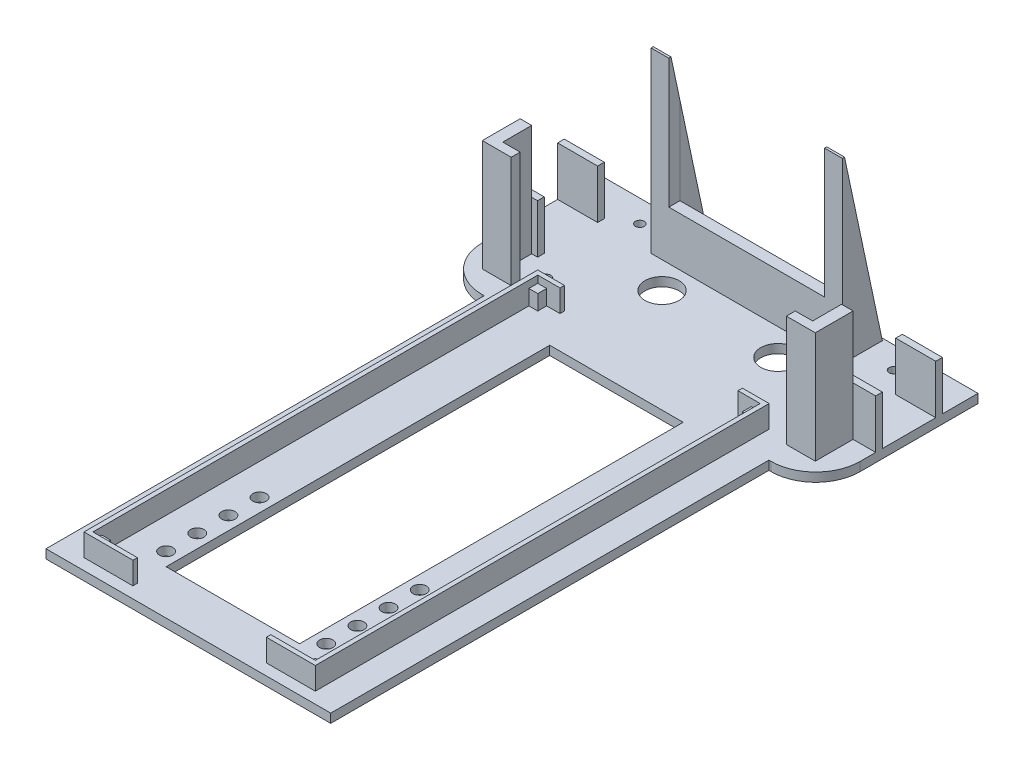
from build123d import *
from OCP.BRepFilletAPI import BRepFilletAPI_MakeChamfer

# Parameters (mm, degrees)
BASE_W               = 85
BASE_H               = 100
BOSS_EXTRUDE2_DEPTH  = 2
SKETCH3_W            = 9
SKETCH3_H            = 1.5
SKETCH3_W_2          = 43
SKETCH3_H_2          = 2.5
BOSS_EXTRUDE4_DEPTH  = 11
SKETCH13_W           = 15
SKETCH13_H           = 61.230763763
SKETCH13_R           = 1
CUT_EXTRUDE2_DEPTH   = 67.537583365
SKETCH14_W           = 2.595547293
SKETCH14_H           = 6.5
SKETCH14_W_2         = 6.5
SKETCH14_H_2         = 2
BOSS_EXTRUDE5_DEPTH  = 25
SKETCH16_W           = 3.995410841
SKETCH16_H           = 2.5
BOSS_EXTRUDE6_DEPTH  = 29
SKETCH18_W           = 4
SKETCH18_H           = 6.5
BOSS_EXTRUDE7_DEPTH  = 40
CHAMFER1_SIZE        = 8.502262467
CHAMFER1_SIZE_2      = 40
SKETCH19_W           = 10.5
SKETCH19_H           = 63.5
CUT_EXTRUDE3_DEPTH   = 77.852130745
BOSS_EXTRUDE8_DEPTH  = 5
FILLET1_R            = 10
SKETCH21_W           = 2
SKETCH21_H           = 2
BOSS_EXTRUDE9_DEPTH  = 3.4
SKETCH22_W           = 64
SKETCH22_H           = 2
BOSS_EXTRUDE10_DEPTH = 35
SKETCH23_R           = 1.5
SKETCH23_W           = 30
SKETCH23_H           = 27.486629776
CUT_EXTRUDE4_DEPTH   = 104.107953137
SKETCH24_W           = 1
SKETCH24_H           = 32.46
SKETCH24_W_2         = 10
SKETCH24_H_2         = 1
BOSS_EXTRUDE11_DEPTH = 5
SKETCH26_W           = 2
SKETCH26_H           = 2
BOSS_EXTRUDE13_DEPTH = 3.4


with BuildPart() as part:
    # base → Boss-Extrude2 (new body)
    with BuildSketch(Plane(origin=(0, 0, 0), x_dir=(1, 0, 0), z_dir=(0, 1, 0))):
        Rectangle(BASE_W, BASE_H)
    extrude(amount=BOSS_EXTRUDE2_DEPTH)

    # Sketch3 → Boss-Extrude4 (add)
    with BuildSketch(Plane(origin=(0, 2, 0), x_dir=(1, 0, 0), z_dir=(0, 1, 0))):
        with Locations((38, 41.25)):
            Rectangle(SKETCH3_W, SKETCH3_H)
        with Locations((38, 27.75)):
            Rectangle(SKETCH3_W, SKETCH3_H)
        with Locations((-38, 41.25)):
            Rectangle(SKETCH3_W, SKETCH3_H)
        with Locations((-38, 27.75)):
            Rectangle(SKETCH3_W, SKETCH3_H)
        with Locations((0, 41.75)):
            Rectangle(SKETCH3_W_2, SKETCH3_H_2)
    extrude(amount=BOSS_EXTRUDE4_DEPTH)

    # Sketch13 → Cut-Extrude2 (cut, through all)
    with BuildSketch(Plane(origin=(0, 2, 0), x_dir=(1, 0, 0), z_dir=(0, 1, 0))):
        with BuildLine():
            ThreePointArc((-16.872793903, 34.5), (-13.024991104, 30.652197201), (-9.177188305, 34.5))
            Line((-9.177188305, 34.5), (-16.872793903, 34.5))
        make_face()
        with BuildLine():
            Line((-16.872793903, 34.5), (-9.177188305, 34.5))
            ThreePointArc((-9.177188305, 34.5), (-13.024991104, 38.347802799), (-16.872793903, 34.5))
        make_face()
        with BuildLine():
            ThreePointArc((9.177188305, 34.5), (13.024991104, 30.652197201), (16.872793903, 34.5))
            Line((16.872793903, 34.5), (9.177188305, 34.5))
        make_face()
        with BuildLine():
            Line((9.177188305, 34.5), (16.872793903, 34.5))
            ThreePointArc((16.872793903, 34.5), (13.024991104, 38.347802799), (9.177188305, 34.5))
        make_face()
        with Locations((-7.5, -19.384618119)):
            Rectangle(SKETCH13_W, SKETCH13_H)
        with Locations((7.5, -19.384618119)):
            Rectangle(SKETCH13_W, SKETCH13_H)
        with Locations(Location((28.5, 45, 0), (0, 0, 270))):
            Circle(SKETCH13_R)
        with Locations(Location((28.5, 24, 0), (0, 0, 90))):
            Circle(SKETCH13_R)
        with Locations(Location((-28.5, 24, 0), (0, 0, 270))):
            Circle(SKETCH13_R)
        with Locations(Location((-28.5, 45, 0), (0, 0, 90))):
            Circle(SKETCH13_R)
    extrude(amount=-CUT_EXTRUDE2_DEPTH, mode=Mode.SUBTRACT)

    # Sketch14 → Boss-Extrude5 (add)
    with BuildSketch(Plane(origin=(0, 2, 0), x_dir=(1, 0, 0), z_dir=(0, 1, 0))):
        with Locations((-36.123593927, 23.75)):
            Rectangle(SKETCH14_W, SKETCH14_H)
        with Locations((-34.171367573, 19.5)):
            Rectangle(SKETCH14_W_2, SKETCH14_H_2)
        with Locations((36.123593927, 23.75)):
            Rectangle(SKETCH14_W, SKETCH14_H)
        Polygon((37.421367573, 20.5), (34.82582028, 20.5), (30.921367573, 20.5), (30.921367573, 18.5), (37.421367573, 18.5), align=None)
    extrude(amount=BOSS_EXTRUDE5_DEPTH)

    # Sketch16 → Boss-Extrude6 (add)
    with BuildSketch(Plane(origin=(0, 13, 0), x_dir=(1, 0, 0), z_dir=(0, 1, 0))):
        with Locations((-19.50229458, 41.75)):
            Rectangle(SKETCH16_W, SKETCH16_H)
        with Locations((19.50229458, 41.75)):
            Rectangle(SKETCH16_W, SKETCH16_H)
    extrude(amount=BOSS_EXTRUDE6_DEPTH)

    # Sketch18 → Boss-Extrude7 (add)
    with BuildSketch(Plane(origin=(0, 2, 0), x_dir=(1, 0, 0), z_dir=(0, 1, 0))):
        with Locations((-19.5, 46.25)):
            Rectangle(SKETCH18_W, SKETCH18_H)
        with Locations((19.5, 46.25)):
            Rectangle(SKETCH18_W, SKETCH18_H)
    extrude(amount=BOSS_EXTRUDE7_DEPTH)

    # Chamfer1
    chamfer1_edges_1 = [part.edges().sort_by_distance(p)[0] for p in [
        (-19.5, 42, -49.5),
    ]]
    chamfer1_side_1 = [part.faces().sort_by_distance(p)[0] for p in [
        (-19.5, 42, -49.329954751),
    ]]
    chamfer1_edges_2 = [part.edges().sort_by_distance(p)[0] for p in [
        (19.5, 42, -49.5),
    ]]
    chamfer1_side_2 = [part.faces().sort_by_distance(p)[0] for p in [
        (19.5, 42, -49.329954751),
    ]]
    chamfer1 = BRepFilletAPI_MakeChamfer(part.part.solid().wrapped)
    for e in chamfer1_edges_1:
        chamfer1.Add(CHAMFER1_SIZE - 0.0001, CHAMFER1_SIZE_2 - 0.0001, e.wrapped, chamfer1_side_1[0].wrapped)
    for e in chamfer1_edges_2:
        chamfer1.Add(CHAMFER1_SIZE - 0.0001, CHAMFER1_SIZE_2 - 0.0001, e.wrapped, chamfer1_side_2[0].wrapped)
    add(Compound.cast(chamfer1.Shape()), mode=Mode.REPLACE)  # a hair under: the kernel refuses the full size

    # Sketch19 → Cut-Extrude3 (cut, through all)
    with BuildSketch(Plane(origin=(0, 2, 0), x_dir=(1, 0, 0), z_dir=(0, 1, 0))):
        with Locations((-37.25, -18.25)):
            Rectangle(SKETCH19_W, SKETCH19_H)
        with Locations((37.25, -18.25)):
            Rectangle(SKETCH19_W, SKETCH19_H)
    extrude(amount=-CUT_EXTRUDE3_DEPTH, mode=Mode.SUBTRACT)

    # Sketch20 → Boss-Extrude8 (add)
    with BuildSketch(Plane(origin=(0, 2, 0), x_dir=(1, 0, 0), z_dir=(0, 1, 0))):
        Polygon((-26, -50), (-25, -50), (-25, 18.538863673), (-20, 18.538863673), (-20, 19.538863673), (-26, 19.538863673), align=None)
        Polygon((20, 18.538863673), (25, 18.538863673), (25, -50), (26, -50), (26, 19.538863673), (20, 19.538863673), align=None)
    extrude(amount=BOSS_EXTRUDE8_DEPTH)

    # Fillet1
    fillet1_edges = [part.edges().sort_by_distance(p)[0] for p in [
        (-42.5, 1, -13.5),
        (42.5, 1, -13.5),
    ]]
    fillet(fillet1_edges, radius=FILLET1_R)

    # Sketch21 → Boss-Extrude9 (add)
    with BuildSketch(Plane(origin=(0, 2, 0), x_dir=(1, 0, 0), z_dir=(0, 1, 0))):
        with Locations((-24, 17.538863673)):
            Rectangle(SKETCH21_W, SKETCH21_H)
        with Locations((24, 17.538863673)):
            Rectangle(SKETCH21_W, SKETCH21_H)
    extrude(amount=BOSS_EXTRUDE9_DEPTH)

    # Sketch22 → Boss-Extrude10 (add)
    with BuildSketch(Plane.XY.offset(50)):
        with Locations((0, 1)):
            Rectangle(SKETCH22_W, SKETCH22_H)
    extrude(amount=BOSS_EXTRUDE10_DEPTH)

    # Sketch23 → Cut-Extrude4 (cut, through all)
    with BuildSketch(Plane(origin=(0, 2, 0), x_dir=(1, 0, 0), z_dir=(0, 1, 0))):
        with Locations(Location((18, -72, 0), (0, 0, 270))):
            Circle(SKETCH23_R)
        with Locations(Location((18, -65, 0), (0, 0, 270))):
            Circle(SKETCH23_R)
        with Locations(Location((18, -58, 0), (0, 0, 270))):
            Circle(SKETCH23_R)
        with Locations(Location((18, -51, 0), (0, 0, 270))):
            Circle(SKETCH23_R)
        with Locations(Location((-18, -51, 0), (0, 0, 90))):
            Circle(SKETCH23_R)
        with Locations(Location((-18, -58, 0), (0, 0, 90))):
            Circle(SKETCH23_R)
        with Locations(Location((-18, -65, 0), (0, 0, 90))):
            Circle(SKETCH23_R)
        with Locations(Location((-18, -72, 0), (0, 0, 90))):
            Circle(SKETCH23_R)
        with Locations((0, -61.256685112)):
            Rectangle(SKETCH23_W, SKETCH23_H)
    extrude(amount=-CUT_EXTRUDE4_DEPTH, mode=Mode.SUBTRACT)

    # Sketch24 → Boss-Extrude11 (add)
    with BuildSketch(Plane(origin=(0, 2, 0), x_dir=(1, 0, 0), z_dir=(0, 1, 0))):
        with Locations((-25.5, -66.23)):
            Rectangle(SKETCH24_W, SKETCH24_H)
        with Locations((-20, -81.96)):
            Rectangle(SKETCH24_W_2, SKETCH24_H_2)
        with Locations((25.5, -66.23)):
            Rectangle(SKETCH24_W, SKETCH24_H)
        with Locations((20, -81.96)):
            Rectangle(SKETCH24_W_2, SKETCH24_H_2)
    extrude(amount=BOSS_EXTRUDE11_DEPTH)

    # Sketch26 → Boss-Extrude13 (add)
    with BuildSketch(Plane(origin=(0, 2, 0), x_dir=(1, 0, 0), z_dir=(0, 1, 0))):
        with Locations((24, -80.46)):
            Rectangle(SKETCH26_W, SKETCH26_H)
        with Locations((-24, -80.46)):
            Rectangle(SKETCH26_W, SKETCH26_H)
    extrude(amount=BOSS_EXTRUDE13_DEPTH)


solid = part.part
